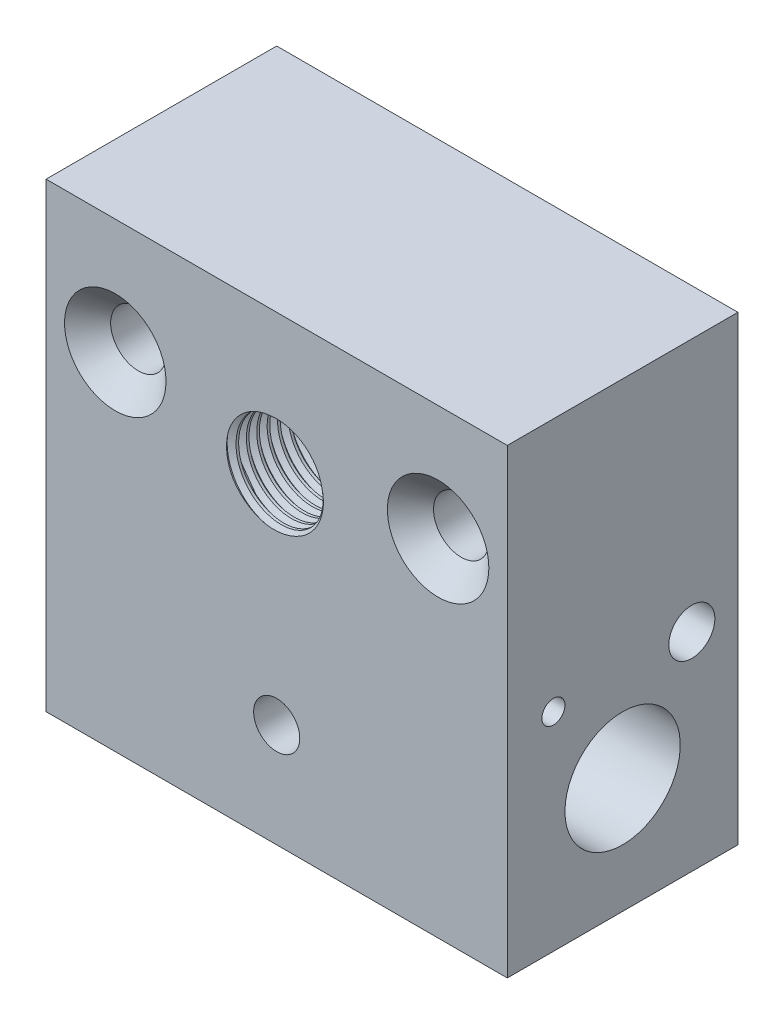
from build123d import *

# Parameters (mm, degrees)
SKETCH1_W                                       = 20
SKETCH1_H                                       = 10
BOSS_EXTRUDE1_DEPTH                             = 20
CSK_FOR_M2_FLAT_HEAD_MACHINE_SCREW1_D           = 2.4
CSK_FOR_M2_FLAT_HEAD_MACHINE_SCREW1_CSINK_D     = 4.4
CSK_FOR_M2_FLAT_HEAD_MACHINE_SCREW1_CSINK_ANGLE = 90
SKETCH6_R                                       = 2
CUT_EXTRUDE1_DEPTH                              = 25.494897428
SKETCH6_3_R                                     = 1
CUT_EXTRUDE3_DEPTH                              = 5
THREAD1_PITCH                                   = 0.45
SKETCH13_R                                      = 2.5
SKETCH13_R_2                                    = 1
SKETCH13_R_3                                    = 0.5
CUT_EXTRUDE2_DEPTH                              = 29.722813389


with BuildPart() as part:
    # Sketch1 → Boss-Extrude1 (new body)
    with BuildSketch(Plane(origin=(0, 0, 0), x_dir=(1, 0, 0), z_dir=(0, 1, 0))):
        Rectangle(SKETCH1_W, SKETCH1_H)
    extrude(amount=BOSS_EXTRUDE1_DEPTH)

    # CSK for M2 Flat Head Machine Screw1 (through all)
    with Locations(Plane.XY.offset(5)):
        with Locations((7, 15), (-7, 15)):
            CounterSinkHole(CSK_FOR_M2_FLAT_HEAD_MACHINE_SCREW1_D / 2, CSK_FOR_M2_FLAT_HEAD_MACHINE_SCREW1_CSINK_D / 2, counter_sink_angle=CSK_FOR_M2_FLAT_HEAD_MACHINE_SCREW1_CSINK_ANGLE)

    # Sketch6 → Cut-Extrude1 (cut, through all)
    with BuildSketch(Plane.XY.offset(5)):
        with Locations((0, 14)):
            Circle(SKETCH6_R)
    extrude(amount=-CUT_EXTRUDE1_DEPTH, mode=Mode.SUBTRACT)

    # Sketch6<3> → Cut-Extrude3 (cut)
    with BuildSketch(Plane.XY.offset(5)):
        with Locations((0, 4.5)):
            Circle(SKETCH6_3_R)
    extrude(amount=-CUT_EXTRUDE3_DEPTH, mode=Mode.SUBTRACT)

    # Thread1: the profile of Thread Profile1 profile screwed along a right-hand helix of 24.444444 turns, 6 arcs to a turn; built about Z, then put on its axis
    thread1_z = Axis((0, 0, 0), (0, 0, 1))
    thread1_corners = [(1.9997, 0, -0.000173205), (2.243569644, 0, 0.140624999), (2.243569644, 0, 0.196874999), (1.9997, 0, 0.337673204)]
    with BuildLine(mode=Mode.PRIVATE) as thread1_profile:
        Line(thread1_corners[0], thread1_corners[1])
        Line(thread1_corners[1], thread1_corners[2])
        Line(thread1_corners[2], thread1_corners[3])
        Line(thread1_corners[3], thread1_corners[0])
    thread1_cap = Face(thread1_profile.wire())
    thread1_turn_angles = [0, 30, 60, 90, 120, 150, 180, 210, 240, 270, 300, 330, 360]
    thread1_turn_weights = [1, 0.8660254037844387, 1, 0.8660254037844387, 1, 0.8660254037844387, 1, 0.8660254037844387, 1, 0.8660254037844387, 1, 0.8660254037844387, 1]
    thread1_turn_rails = [Edge.make_bspline([Vector(p[0], p[1], 0).rotate(thread1_z, thread1_turn_angles[k]) / thread1_turn_weights[k] + Vector(0, 0, p[2] + THREAD1_PITCH * thread1_turn_angles[k] / 360) for k in range(13)], [0, 0, 0, 1, 1, 2, 2, 3, 3, 4, 4, 5, 5, 6, 6, 6], 2, thread1_turn_weights) for p in thread1_corners]
    thread1_turn_sides = [Face.make_surface_from_curves(thread1_turn_rails[p[0]], thread1_turn_rails[p[1]]) for p in [(0, 1), (1, 2), (2, 3), (3, 0)]]
    thread1_last_angles = [8640, 8670, 8700, 8730, 8760, 8780, 8800]
    thread1_last_weights = [1, 0.8660254037844387, 1, 0.8660254037844387, 1, 0.939692620785903, 1]
    thread1_last_rails = [Edge.make_bspline([Vector(p[0], p[1], 0).rotate(thread1_z, thread1_last_angles[k]) / thread1_last_weights[k] + Vector(0, 0, p[2] + THREAD1_PITCH * thread1_last_angles[k] / 360) for k in range(7)], [0, 0, 0, 1, 1, 2, 2, 3, 3, 3], 2, thread1_last_weights) for p in thread1_corners]
    thread1_last_sides = [Face.make_surface_from_curves(thread1_last_rails[p[0]], thread1_last_rails[p[1]]) for p in [(0, 1), (1, 2), (2, 3), (3, 0)]]
    thread1 = Plane(origin=(0, 14, 6), x_dir=(-1, 0, 0), z_dir=(0, 0, -1)) * Solid(Shell([*[p.moved(Location((0, 0, THREAD1_PITCH * i))) for i in range(24) for p in thread1_turn_sides], *thread1_last_sides, thread1_cap, thread1_cap.rotate(thread1_z, 8800).moved(Location((0, 0, THREAD1_PITCH * 8800 / 360)))]))
    add(thread1, mode=Mode.SUBTRACT)

    # Sketch13 → Cut-Extrude2 (cut, through all)
    with BuildSketch(Plane.ZY.offset(10)):
        with Locations((0, 5)):
            Circle(SKETCH13_R)
        with Locations((-3, 9)):
            Circle(SKETCH13_R_2)
        with Locations((3, 9)):
            Circle(SKETCH13_R_3)
    extrude(amount=-CUT_EXTRUDE2_DEPTH, mode=Mode.SUBTRACT)


solid = part.part
